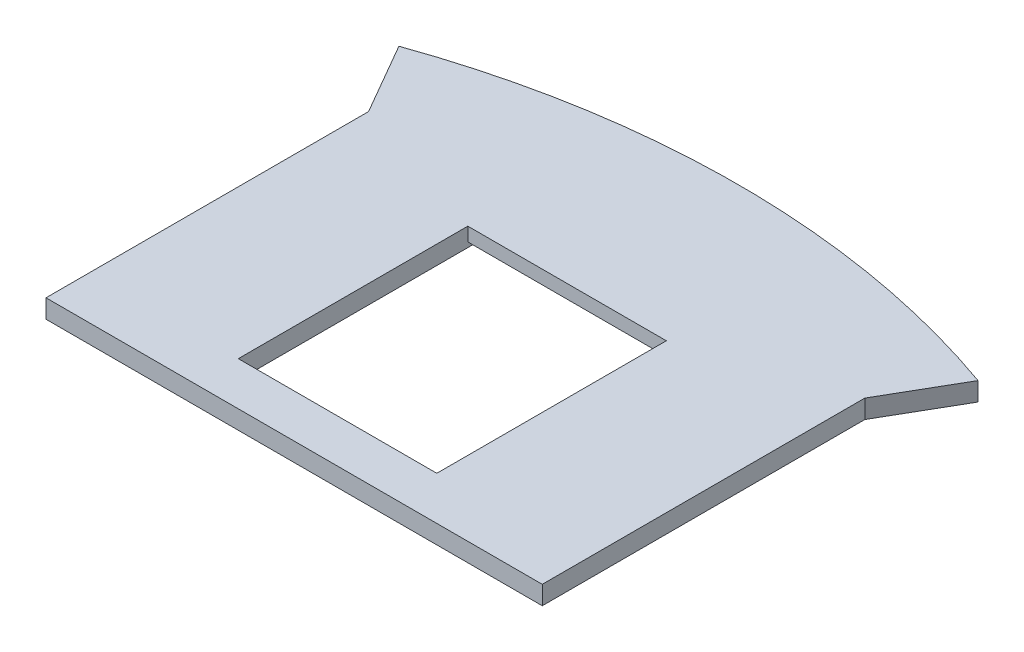
from build123d import *

# Parameters (mm, degrees)
BOSS_EXTRUDE1_DEPTH = 3
CUT_EXTRUDE1_REACH  = 149.227
SKETCH2_W           = 32
SKETCH2_H           = 37
SKETCH3_W           = 32
SKETCH3_H           = 44
CUT_EXTRUDE2_DEPTH  = 0.8


with BuildPart() as part:
    # Sketch1 → Boss-Extrude1 (new body)
    with BuildSketch(Plane(origin=(0, 0, 0), x_dir=(1, 0, 0), z_dir=(0, 1, 0))):
        with BuildLine():
            Line((-40, 68), (-40, 120))
            Line((-40, 120), (-46.677171015, 131.565199449))
            ThreePointArc((-46.677171015, 131.565199449), (0, 139.6), (46.677171015, 131.565199449))
            Line((46.677171015, 131.565199449), (40, 120))
            Line((40, 120), (40, 68))
            Line((40, 68), (-40, 68))
        make_face()
    extrude(amount=BOSS_EXTRUDE1_DEPTH)

    # Sketch2 → Cut-Extrude1 (cut, up to next)
    with BuildSketch(Plane(origin=(0, 3, 0), x_dir=(1, 0, 0), z_dir=(0, 1, 0)), mode=Mode.PRIVATE) as cut_extrude1_sk1:
        with Locations((0, 93.5)):
            Rectangle(SKETCH2_W, SKETCH2_H)
    cut_extrude1_tool1 = extrude(cut_extrude1_sk1.sketch, amount=-CUT_EXTRUDE1_REACH, mode=Mode.PRIVATE) & part.part
    add(cut_extrude1_tool1.solids().sort_by_distance((0, 3, -93.5))[0], mode=Mode.SUBTRACT)

    # Sketch3 → Cut-Extrude2 (cut)
    with BuildSketch(Plane.XZ):
        with Locations((0, -93.5)):
            Rectangle(SKETCH3_W, SKETCH3_H)
    extrude(amount=-CUT_EXTRUDE2_DEPTH, mode=Mode.SUBTRACT)


solid = part.part
